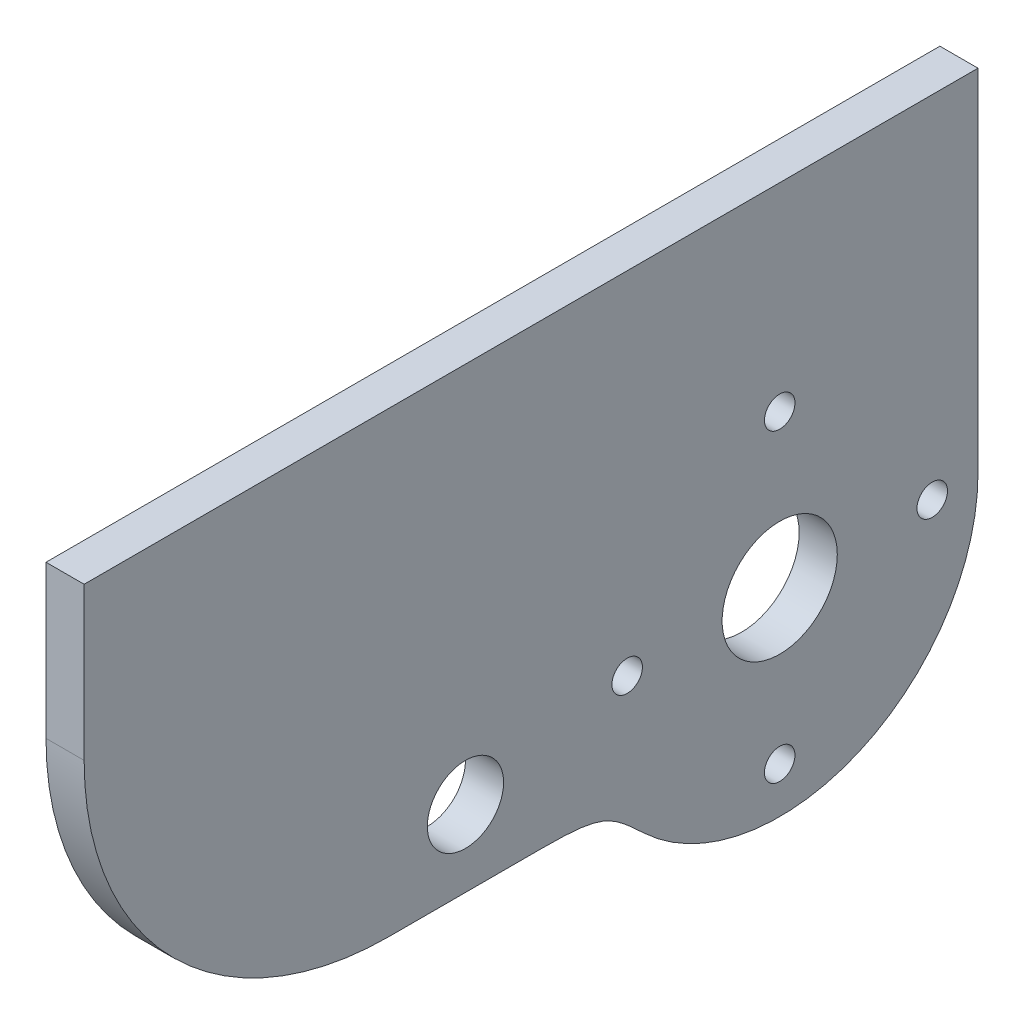
from build123d import *

# Parameters (mm, degrees)
SKETCH1_R           = 6.35
SKETCH1_R_2         = 2.54
SKETCH1_R_3         = 9.5885
BOSS_EXTRUDE1_DEPTH = 6.35


with BuildPart() as part:
    # Sketch1 → Boss-Extrude1 (new body)
    with BuildSketch(Plane(origin=(0, 0, 0), x_dir=(0, 0, -1), z_dir=(1, 0, 0))):
        with BuildLine():
            Line((0, 0), (148.852013949, 0))
            Line((148.852013949, 0), (148.852013949, -58.42))
            ThreePointArc((148.852013949, -58.42), (128.967176049, -88.715014716), (93.262194651, -82.52235791))
            add(Edge.make_bspline(
                [(76.2, -76.2), (86.409534639, -76.2), (87.677484192, -77.292748991), (93.262194651, -82.52235791)],
                knots=[0, 0, 0, 0, 1, 1, 1, 1], degree=3))
            Line((76.2, -76.2), (50.8, -76.2))
            ThreePointArc((50.8, -76.2), (14.878975516, -61.321024484), (0, -25.4))
            Line((0, -25.4), (0, 0))
        make_face()
        with Locations((63.5, -63.5)):
            Circle(SKETCH1_R, mode=Mode.SUBTRACT)
        with Locations((115.832013949, -33.02)):
            Circle(SKETCH1_R_2, mode=Mode.SUBTRACT)
        with Locations((141.232013949, -58.42)):
            Circle(SKETCH1_R_2, mode=Mode.SUBTRACT)
        with Locations((115.832013949, -83.82)):
            Circle(SKETCH1_R_2, mode=Mode.SUBTRACT)
        with Locations((115.832013949, -58.42)):
            Circle(SKETCH1_R_3, mode=Mode.SUBTRACT)
        with Locations((90.432013949, -58.42)):
            Circle(SKETCH1_R_2, mode=Mode.SUBTRACT)
    extrude(amount=BOSS_EXTRUDE1_DEPTH)


solid = part.part
